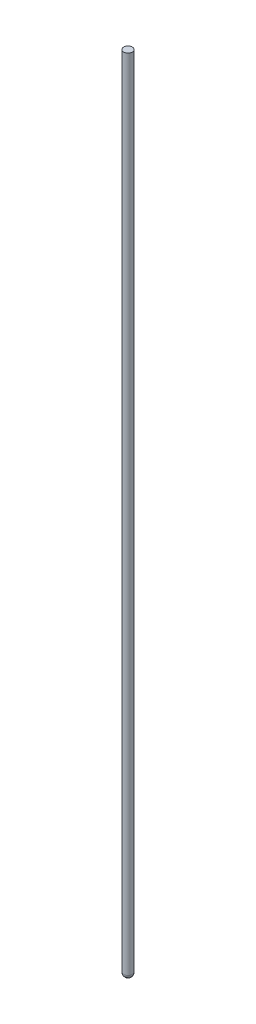
from build123d import *

# Parameters (mm, degrees)
SKETCH1_R           = 5.08
BOSS_EXTRUDE1_DEPTH = 934.72
FILLET1_R           = 4.953


with BuildPart() as part:
    # Sketch1 → Boss-Extrude1 (new body)
    with BuildSketch(Plane(origin=(0, 0, 0), x_dir=(1, 0, 0), z_dir=(0, 1, 0))):
        Circle(SKETCH1_R)
    extrude(amount=BOSS_EXTRUDE1_DEPTH)

    # Fillet1
    fillet1_edges = [part.edges().sort_by_distance(p)[0] for p in [
        (-5.08, 0, 0),
    ]]
    fillet(fillet1_edges, radius=FILLET1_R)


solid = part.part
